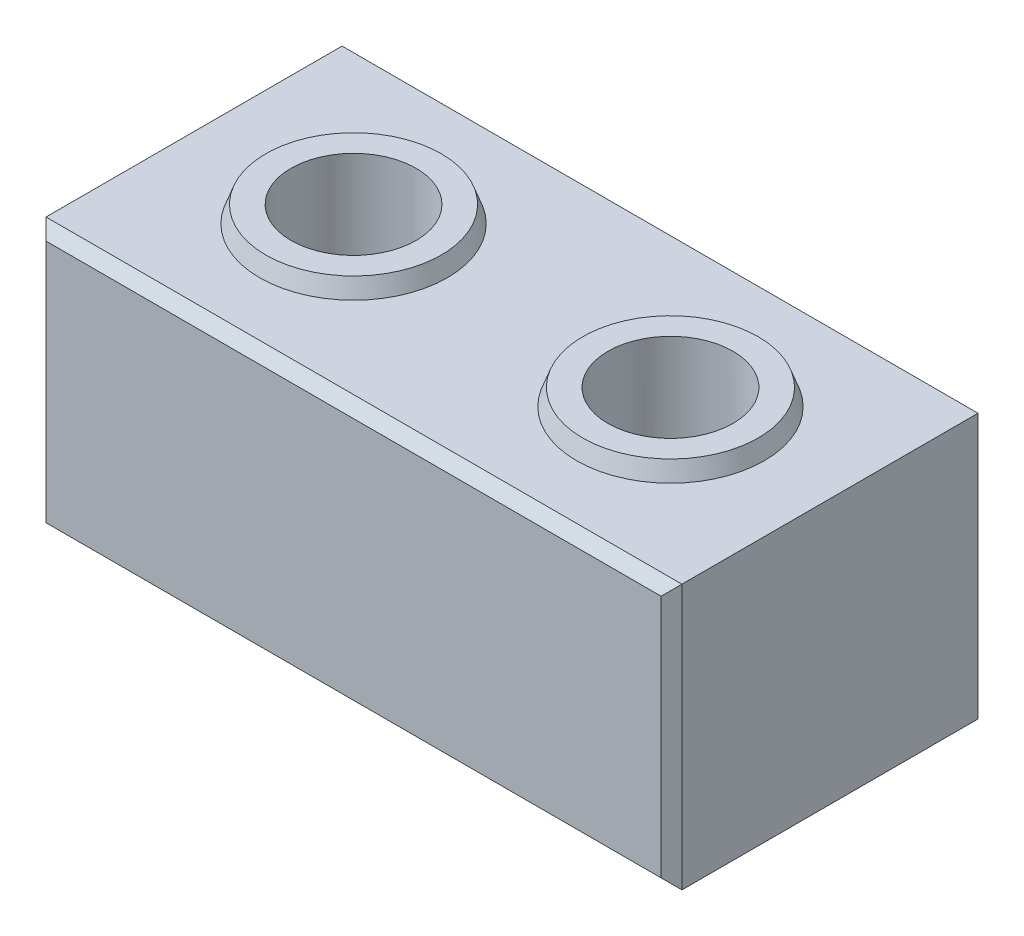
from build123d import *
from OCP.BRepFilletAPI import BRepFilletAPI_MakeChamfer

# Parameters (mm, degrees)
SKETCH1_W           = 305
SKETCH1_H           = 152
BOSS_EXTRUDE1_DEPTH = 127
SKETCH2_R           = 30
CUT_EXTRUDE1_DEPTH  = 213.51176438
BOSS_EXTRUDE2_START = 8
SKETCH3_R           = 45
SKETCH3_R_2         = 30
BOSS_EXTRUDE2_DEPTH = 8
CHAMFER1_SIZE       = 2.911761874
CHAMFER1_SIZE_2     = 8
CUT_EXTRUDE2_START  = -10
SKETCH4_R           = 46
SKETCH4_R_2         = 30
CUT_EXTRUDE2_DEPTH  = 10
CHAMFER2_SIZE       = 3.639702343
CHAMFER2_SIZE_2     = 10
CHAMFER3_SIZE       = 5


with BuildPart() as part:
    # Sketch1 → Boss-Extrude1 (new body)
    with BuildSketch(Plane(origin=(0, 0, 0), x_dir=(1, 0, 0), z_dir=(0, 1, 0))):
        Rectangle(SKETCH1_W, SKETCH1_H)
    extrude(amount=-BOSS_EXTRUDE1_DEPTH)

    # Sketch2 → Cut-Extrude1 (cut, through all)
    with BuildSketch(Plane(origin=(0, 0, 0), x_dir=(1, 0, 0), z_dir=(0, 1, 0))):
        with Locations(Location((-76, 0, 0), (0, 0, 270))):
            Circle(SKETCH2_R)
        with Locations(Location((76, 0, 0), (0, 0, 90))):
            Circle(SKETCH2_R)
    extrude(amount=-CUT_EXTRUDE1_DEPTH, mode=Mode.SUBTRACT)

    # Sketch3 → Boss-Extrude2 (add)
    # profile 1 of 2: a face of its own
    with BuildSketch(Plane(origin=(0, 0, 0), x_dir=(1, 0, 0), z_dir=(0, 1, 0)).offset(BOSS_EXTRUDE2_START)):
        with Locations(Location((-76, 0, 0), (0, 0, 270))):
            Circle(SKETCH3_R)
        with Locations(Location((-76, 0, 0), (0, 0, 270))):
            Circle(SKETCH3_R_2, mode=Mode.SUBTRACT)
    # profile 2 of 2: a face of its own
    with BuildSketch(Plane(origin=(0, 0, 0), x_dir=(1, 0, 0), z_dir=(0, 1, 0)).offset(BOSS_EXTRUDE2_START)):
        with Locations(Location((76, 0, 0), (0, 0, 90))):
            Circle(SKETCH3_R)
        with Locations(Location((76, 0, 0), (0, 0, 90))):
            Circle(SKETCH3_R_2, mode=Mode.SUBTRACT)
    extrude(amount=-BOSS_EXTRUDE2_DEPTH)

    # Chamfer1
    chamfer1_edges_1 = [part.edges().sort_by_distance(p)[0] for p in [
        (-76, 8, -45),
    ]]
    chamfer1_side_1 = [part.faces().sort_by_distance(p)[0] for p in [
        (-76, 8, -44.941764763),
    ]]
    chamfer1_edges_2 = [part.edges().sort_by_distance(p)[0] for p in [
        (76, 8, 45),
    ]]
    chamfer1_side_2 = [part.faces().sort_by_distance(p)[0] for p in [
        (76, 8, 44.941764763),
    ]]
    chamfer1 = BRepFilletAPI_MakeChamfer(part.part.solid().wrapped)
    for e in chamfer1_edges_1:
        chamfer1.Add(CHAMFER1_SIZE - 0.0001, CHAMFER1_SIZE_2 - 0.0001, e.wrapped, chamfer1_side_1[0].wrapped)
    for e in chamfer1_edges_2:
        chamfer1.Add(CHAMFER1_SIZE - 0.0001, CHAMFER1_SIZE_2 - 0.0001, e.wrapped, chamfer1_side_2[0].wrapped)
    add(Compound.cast(chamfer1.Shape()), mode=Mode.REPLACE)  # a hair under: the kernel refuses the full size

    # Sketch4 → Cut-Extrude2 (cut)
    # profile 1 of 2: a face of its own
    with BuildSketch(Plane.XZ.offset(127).offset(CUT_EXTRUDE2_START)):
        with Locations(Location((-76, 0, 0), (0, 0, 270))):
            Circle(SKETCH4_R)
        with Locations(Location((-76, 0, 0), (0, 0, 90))):
            Circle(SKETCH4_R_2, mode=Mode.SUBTRACT)
    # profile 2 of 2: a face of its own
    with BuildSketch(Plane.XZ.offset(127).offset(CUT_EXTRUDE2_START)):
        with Locations(Location((76, 0, 0), (0, 0, 90))):
            Circle(SKETCH4_R)
        with Locations(Location((76, 0, 0), (0, 0, 90))):
            Circle(SKETCH4_R_2, mode=Mode.SUBTRACT)
    extrude(amount=CUT_EXTRUDE2_DEPTH, mode=Mode.SUBTRACT)

    # Chamfer2
    chamfer2_edges_1 = [part.edges().sort_by_distance(p)[0] for p in [
        (-76, -117, 46),
    ]]
    chamfer2_side_1 = [part.faces().sort_by_distance(p)[0] for p in [
        (-76, -117, 45.927205953),
    ]]
    chamfer2_edges_2 = [part.edges().sort_by_distance(p)[0] for p in [
        (76, -117, -46),
    ]]
    chamfer2_side_2 = [part.faces().sort_by_distance(p)[0] for p in [
        (76, -117.072794047, -46),
    ]]
    chamfer2 = BRepFilletAPI_MakeChamfer(part.part.solid().wrapped)
    for e in chamfer2_edges_1:
        chamfer2.Add(CHAMFER2_SIZE - 0.0001, CHAMFER2_SIZE_2 - 0.0001, e.wrapped, chamfer2_side_1[0].wrapped)
    for e in chamfer2_edges_2:
        chamfer2.Add(CHAMFER2_SIZE_2 - 0.0001, CHAMFER2_SIZE - 0.0001, e.wrapped, chamfer2_side_2[0].wrapped)
    add(Compound.cast(chamfer2.Shape()), mode=Mode.REPLACE)  # a hair under: the kernel refuses the full size

    # Chamfer3
    chamfer3_edges = [part.edges().sort_by_distance(p)[0] for p in [
        (0, -127, -76),
        (0, 0, -76),
        (0, 0, 76),
        (-152.5, -63.5, -76),
        (152.5, -63.5, -76),
        (152.5, -63.5, 76),
        (-152.5, -63.5, 76),
        (0, -127, 76),
    ]]
    chamfer(chamfer3_edges, length=CHAMFER3_SIZE)


solid = part.part
